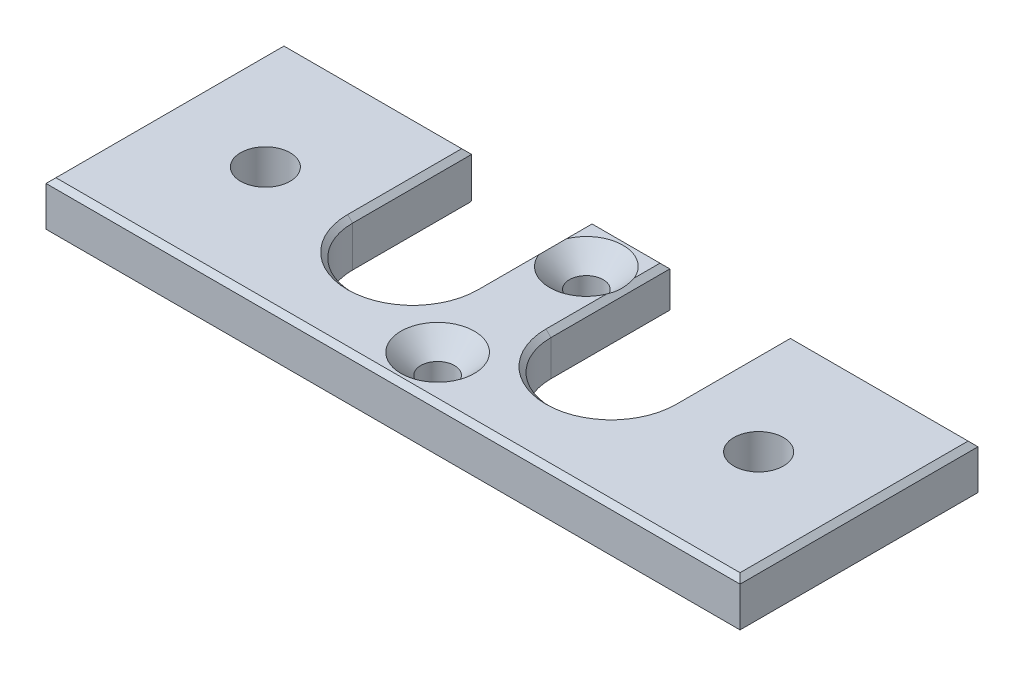
from build123d import *

# Parameters (mm, degrees)
SKETCH1_R           = 1.7
SKETCH1_R_2         = 2.5
BOSS_EXTRUDE1_DEPTH = 5
CHAMFER2_SIZE       = 2
CUT_EXTRUDE1_DEPTH  = 0.4
CHAMFER1_SIZE       = 0.5


with BuildPart() as part:
    # Sketch1 → Boss-Extrude1 (new body)
    with BuildSketch(Plane(origin=(0, 0, 0), x_dir=(1, 0, 0), z_dir=(0, 1, 0))):
        with BuildLine():
            Line((-35, -12), (35, -12))
            Line((35, -12), (35, 12))
            Line((35, 12), (16.075, 12))
            Line((16.075, 12), (16.075, 0))
            ThreePointArc((16.075, 0), (10, -6.075), (3.925, 0))
            Line((3.925, 0), (3.925, 12))
            Line((3.925, 12), (-3.925, 12))
            Line((-3.925, 12), (-3.925, 0))
            ThreePointArc((-3.925, 0), (-10, -6.075), (-16.075, 0))
            Line((-16.075, 0), (-16.075, 12))
            Line((-16.075, 12), (-35, 12))
            Line((-35, 12), (-35, -12))
        make_face()
        with Locations(Location((0, -7.5, 0), (0, 0, 270))):
            Circle(SKETCH1_R, mode=Mode.SUBTRACT)
        with Locations(Location((-24.875, 0, 0), (0, 0, 270))):
            Circle(SKETCH1_R_2, mode=Mode.SUBTRACT)
        with Locations(Location((24.875, 0, 0), (0, 0, 270))):
            Circle(SKETCH1_R_2, mode=Mode.SUBTRACT)
        with Locations(Location((0, 7.5, 0), (0, 0, 270))):
            Circle(SKETCH1_R, mode=Mode.SUBTRACT)
    extrude(amount=BOSS_EXTRUDE1_DEPTH)

    # Chamfer2
    chamfer2_edges = [part.edges().sort_by_distance(p)[0] for p in [
        (0, 5, 5.8),
        (0, 5, -9.2),
    ]]
    chamfer(chamfer2_edges, length=CHAMFER2_SIZE)

    # Sketch2 → Cut-Extrude1 (cut)
    with BuildSketch(Plane.XZ):
        with BuildLine():
            Line((-1.525, 0), (-1.525, -12))
            Line((-1.525, -12), (-18.475, -12))
            Line((-18.475, -12), (-18.475, 0))
            ThreePointArc((-18.475, 0), (-10, 8.475), (-1.525, 0))
        make_face()
        with BuildLine():
            Line((18.475, -12), (1.525, -12))
            Line((1.525, -12), (1.525, 0))
            ThreePointArc((1.525, 0), (10, 8.475), (18.475, 0))
            Line((18.475, 0), (18.475, -12))
        make_face()
    extrude(amount=-CUT_EXTRUDE1_DEPTH, mode=Mode.SUBTRACT)

    # Chamfer1
    chamfer1_edges = [part.edges().sort_by_distance(p)[0] for p in [
        (0, 0, 12),
    ]]
    chamfer(chamfer1_edges, length=CHAMFER1_SIZE)
    chamfer1_2_edges = [part.edges().sort_by_distance(p)[0] for p in [
        (0, 5, 12),
    ]]
    chamfer(chamfer1_2_edges, length=CHAMFER1_SIZE)
    chamfer1_3_edges = [part.edges().sort_by_distance(p)[0] for p in [
        (16.075, 0.4, -6),
        (10, 0.4, 6.075),
        (3.925, 0.4, -6),
    ]]
    chamfer(chamfer1_3_edges, length=CHAMFER1_SIZE)
    chamfer1_4_edges = [part.edges().sort_by_distance(p)[0] for p in [
        (35, 0, -0.25),
    ]]
    chamfer(chamfer1_4_edges, length=CHAMFER1_SIZE)
    chamfer1_5_edges = [part.edges().sort_by_distance(p)[0] for p in [
        (-35, 0, -0.25),
    ]]
    chamfer(chamfer1_5_edges, length=CHAMFER1_SIZE)
    chamfer1_6_edges = [part.edges().sort_by_distance(p)[0] for p in [
        (-35, 5, -0.25),
    ]]
    chamfer(chamfer1_6_edges, length=CHAMFER1_SIZE)
    chamfer1_7_edges = [part.edges().sort_by_distance(p)[0] for p in [
        (35, 5, -0.25),
    ]]
    chamfer(chamfer1_7_edges, length=CHAMFER1_SIZE)
    chamfer1_8_edges = [part.edges().sort_by_distance(p)[0] for p in [
        (25.2875, 5, -12),
    ]]
    chamfer(chamfer1_8_edges, length=CHAMFER1_SIZE)
    chamfer1_9_edges = [part.edges().sort_by_distance(p)[0] for p in [
        (-25.2875, 5, -12),
    ]]
    chamfer(chamfer1_9_edges, length=CHAMFER1_SIZE)
    chamfer1_10_edges = [part.edges().sort_by_distance(p)[0] for p in [
        (26.4875, 0, -12),
    ]]
    chamfer(chamfer1_10_edges, length=CHAMFER1_SIZE)
    chamfer1_11_edges = [part.edges().sort_by_distance(p)[0] for p in [
        (-26.4875, 0, -12),
    ]]
    chamfer(chamfer1_11_edges, length=CHAMFER1_SIZE)
    chamfer1_12_edges = [part.edges().sort_by_distance(p)[0] for p in [
        (0, 5, -12),
    ]]
    chamfer(chamfer1_12_edges, length=CHAMFER1_SIZE)
    chamfer1_13_edges = [part.edges().sort_by_distance(p)[0] for p in [
        (0, 0, -12),
    ]]
    chamfer(chamfer1_13_edges, length=CHAMFER1_SIZE)
    # the kernel refuses this chamfer: 0.5 mm, written as the material it takes off along each edge
    with BuildSketch(Plane(origin=(16.075, 5, -12.785841494), x_dir=(0.9996219169112968, 0.02749587661058555, 0), z_dir=(0, 0, 1)), Plane(origin=(3.925, 5, 0), x_dir=(-0.9996219169112968, 0.027495876610585623, 0), z_dir=(0, 0, -1))) as chamfer1_14_piece_1:
        with BuildLine():
            Line((0.514336598, 0), (-0.028273577, -0.513558897))
            Line((-0.028273577, -0.513558897), (-0.038269797, -0.513283938))
            ThreePointArc((-0.038269797, -0.513283938), (-0.017064614, -0.256698915), (-0.009996219, 0.000274959))
            Line((-0.009996219, 0.000274959), (0.000274959, 0.009996219))
            ThreePointArc((0.000274959, 0.009996219), (0.257248832, 0.002927825), (0.514611556, 0.009996219))
            Line((0.514611556, 0.009996219), (0.514336598, 0))
        make_face()
    extrude(amount=12.785841494, mode=Mode.SUBTRACT)
    with BuildSketch(Plane(origin=(10, 5, 0), x_dir=(1, 0, 0), z_dir=(0, 0, -1))) as chamfer1_14_piece_2:
        with BuildLine():
            Line((6.589142136, -0.014142136), (6.060857864, 0.514142136))
            Line((6.060857864, 0.514142136), (6.050857864, 0.514142136))
            ThreePointArc((6.050857864, 0.514142136), (6.065, 0.257071068), (6.065, 0))
            Line((6.065, 0), (6.075, -0.01))
            ThreePointArc((6.075, -0.01), (6.332071068, -0.01), (6.589142136, -0.024142136))
            Line((6.589142136, -0.024142136), (6.589142136, -0.014142136))
        make_face()
    revolve(axis=Axis((10, 5, 0), (0, -1, 0)), revolution_arc=180, mode=Mode.SUBTRACT)
    # the kernel refuses this chamfer: 0.5 mm, written as the material it takes off along each edge
    with BuildSketch(Plane(origin=(-3.925, 5, -12.785841494), x_dir=(-0.02749587661058651, -0.9996219169112968, 0), z_dir=(0, 0, 1))) as chamfer1_15_piece_1:
        with BuildLine():
            Line((0.514336598, 0), (-0.028273577, 0.513558897))
            Line((-0.028273577, 0.513558897), (-0.038269797, 0.513283938))
            ThreePointArc((-0.038269797, 0.513283938), (-0.017064614, 0.256698915), (-0.009996219, -0.000274959))
            Line((-0.009996219, -0.000274959), (0.000274959, -0.009996219))
            ThreePointArc((0.000274959, -0.009996219), (0.257248832, -0.002927825), (0.514611556, -0.009996219))
            Line((0.514611556, -0.009996219), (0.514336598, 0))
        make_face()
    extrude(amount=12.785841494, mode=Mode.SUBTRACT)
    with BuildSketch(Plane(origin=(-10, 5, 0), x_dir=(1, 0, 0), z_dir=(0, 0, -1))) as chamfer1_15_piece_2:
        with BuildLine():
            Line((6.589142136, -0.014142136), (6.060857864, 0.514142136))
            Line((6.060857864, 0.514142136), (6.050857864, 0.514142136))
            ThreePointArc((6.050857864, 0.514142136), (6.065, 0.257071068), (6.065, 0))
            Line((6.065, 0), (6.075, -0.01))
            ThreePointArc((6.075, -0.01), (6.332071068, -0.01), (6.589142136, -0.024142136))
            Line((6.589142136, -0.024142136), (6.589142136, -0.014142136))
        make_face()
    revolve(axis=Axis((-10, 5, 0), (0, -1, 0)), revolution_arc=180, mode=Mode.SUBTRACT)
    with BuildSketch(Plane(origin=(-16.075, 5, 0), x_dir=(-0.9996219169112968, 0.02749587661058555, 0), z_dir=(0, 0, -1))) as chamfer1_15_piece_3:
        with BuildLine():
            Line((0.514336598, 0), (-0.028273577, -0.513558897))
            Line((-0.028273577, -0.513558897), (-0.038269797, -0.513283938))
            ThreePointArc((-0.038269797, -0.513283938), (-0.017064614, -0.256698915), (-0.009996219, 0.000274959))
            Line((-0.009996219, 0.000274959), (0.000274959, 0.009996219))
            ThreePointArc((0.000274959, 0.009996219), (0.257248832, 0.002927825), (0.514611556, 0.009996219))
            Line((0.514611556, 0.009996219), (0.514336598, 0))
        make_face()
    extrude(amount=12.785841494, mode=Mode.SUBTRACT)


solid = part.part
